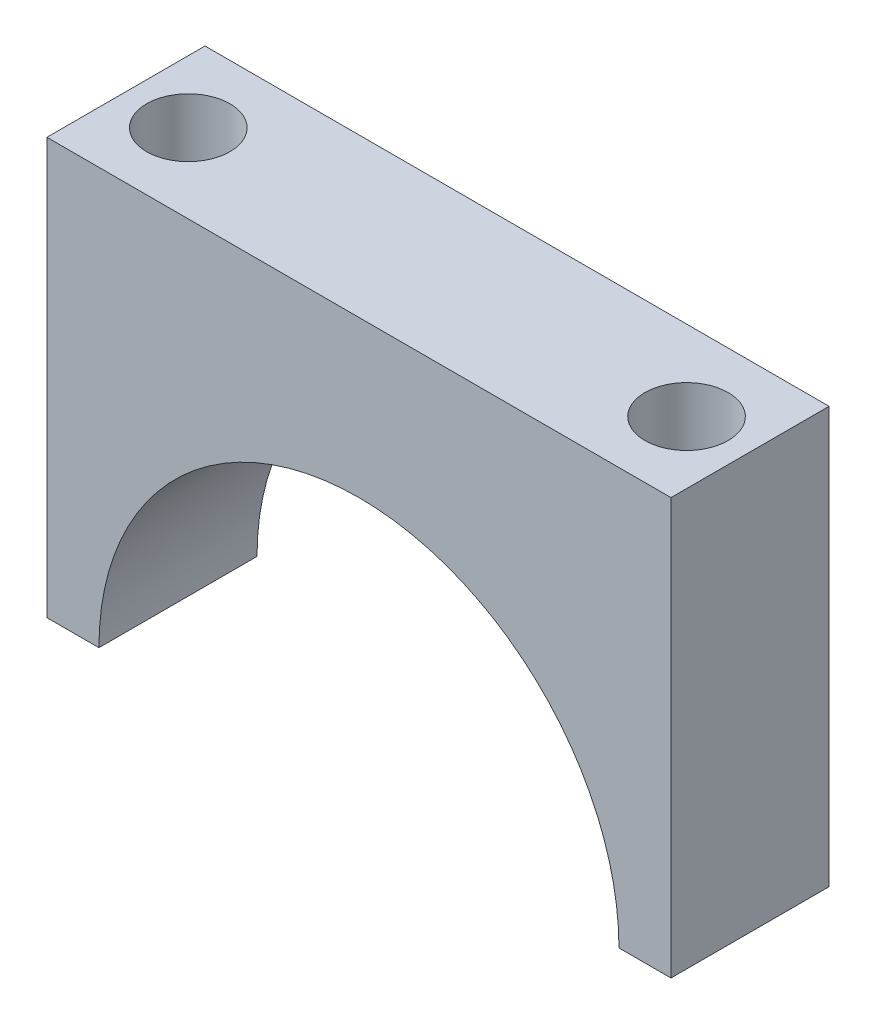
from build123d import *

# Parameters (mm, degrees)
BOSS_EXTRUDE1_DEPTH = 9.652
SKETCH2_R           = 2.54
CUT_EXTRUDE1_DEPTH  = 5.08
SKETCH3_R           = 15.875
CUT_EXTRUDE2_DEPTH  = 50.038


with BuildPart() as part:
    # Sketch1 → Boss-Extrude1 (new body)
    with BuildSketch(Plane.XY):
        Polygon((2492.485807356, 1406.040504477), (2492.485807356, 1431.440504477), (2530.585807356, 1431.440504477), (2530.585807356, 1406.040504477), (2527.410807356, 1406.040504477), (2495.660807356, 1406.040504477), align=None)
    extrude(amount=BOSS_EXTRUDE1_DEPTH)

    # Sketch2 → Cut-Extrude1 (cut)
    with BuildSketch(Plane(origin=(0, 1431.440504477, 0), x_dir=(1, 0, 0), z_dir=(0, 1, 0))):
        with Locations((2496.295807356, -4.831087321)):
            Circle(SKETCH2_R)
        with Locations((2526.775807356, -4.892327606)):
            Circle(SKETCH2_R)
    extrude(amount=-CUT_EXTRUDE1_DEPTH, mode=Mode.SUBTRACT)

    # Sketch3 → Cut-Extrude2 (cut)
    with BuildSketch(Plane.XY.offset(9.652)):
        with Locations((2511.535807356, 1406.040504477)):
            Circle(SKETCH3_R)
    extrude(amount=-CUT_EXTRUDE2_DEPTH, mode=Mode.SUBTRACT)


solid = part.part
